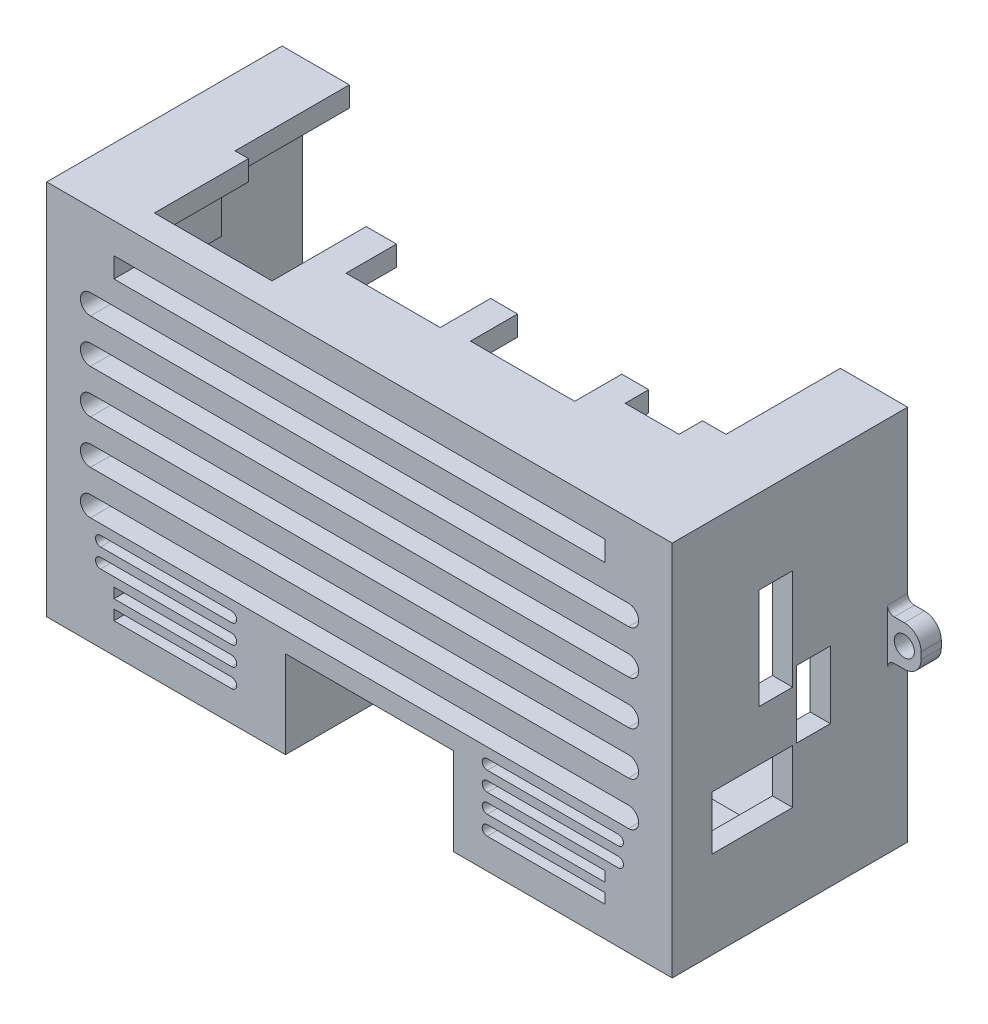
from build123d import *

# Parameters (mm, degrees)
EXTRUDE_1_DEPTH     = 35
CUT_EXTRUDE_1_DEPTH = 18
SKETCH_3_3_W        = 7
SKETCH_3_3_H        = 7
SKETCH_3_3_R        = 2
EXTRUDE_2_DEPTH     = 18
SKETCH_2_W          = 7
SKETCH_2_H          = 15.5
SKETCH_2_H_2        = 1.5
SKETCH_2_W_2        = 3
EXTRUDE_3_DEPTH     = 3
SKETCH_4_W          = 5
SKETCH_4_H          = 15
SKETCH_4_W_2        = 4
SKETCH_4_H_2        = 10
SKETCH_4_W_3        = 12
SKETCH_4_H_3        = 8
SKETCH_4_W_4        = 1
CUT_EXTRUDE_2_DEPTH = 3
CUT_EXTRUDE_START   = -16
SKETCH_3_5_W        = 7
SKETCH_3_5_H        = 7
SKETCH_3_5_R        = 2
CUT_EXTRUDE_3_DEPTH = 2
SKETCH_5_W          = 93
SKETCH_5_H          = 56
EXTRUDE_4_DEPTH     = 3
SKETCH_3_7_W        = 25
SKETCH_3_7_H        = 3
SKETCH_3_7_H_2      = 10
SKETCH_3_7_W_2      = 4
SKETCH_3_7_H_3      = 2.5
CUT_EXTRUDE_4_DEPTH = 18
SKETCH_6_W          = 73
SKETCH_6_H          = 3
CUT_EXTRUDE_5_DEPTH = 3
SKETCH_8_R          = 1.5
EXTRUDE_5_DEPTH     = 3


# Read off the part's stored shape, not the designer's step: 凸台-拉伸1
with BuildPart() as part:
    # 凸台-拉伸1 outline → 凸台-拉伸1 (new body)
    with BuildSketch(Plane.XY):
        Polygon((43.5, -25), (-43.5, -25), (-43.5, 25), (-36.5, 25), (-36.5, 28), (-46.5, 28), (-46.5, -28), (46.5, -28), (46.5, 28), (36.5, 28), (36.5, 25), (43.5, 25), align=None)
    extrude(amount=EXTRUDE_1_DEPTH)

    # 草图3 → 切除-拉伸1 (cut)
    with BuildSketch(Plane.XY.offset(35)):
        Polygon((-46.5, -28), (-36.5, -28), (-36.5, -25), (-43.5, -25), (-43.5, -18), (-46.5, -18), align=None)
        Polygon((36.5, -25), (36.5, -28), (46.5, -28), (46.5, 18), (43.5, 18), (43.5, -25), align=None)
        Polygon((-43.5, 25), (-36.5, 25), (-36.5, 28), (-46.5, 28), (-46.5, 18), (-43.5, 18), align=None)
    extrude(amount=-CUT_EXTRUDE_1_DEPTH, mode=Mode.SUBTRACT)

    # 草图3<3> → 凸台-拉伸2 (add)
    # profile 1 of 9: a face of its own
    with BuildSketch(Plane.XY.offset(35)):
        with Locations((-40, 21.5)):
            Rectangle(SKETCH_3_3_W, SKETCH_3_3_H)
        with Locations((-39.5, 21)):
            Circle(SKETCH_3_3_R, mode=Mode.SUBTRACT)
    # profile 2 of 9: a face of its own
    with BuildSketch(Plane.XY.offset(35)):
        with Locations((-40, -21.5)):
            Rectangle(SKETCH_3_3_W, SKETCH_3_3_H)
        with Locations((-39.5, -21)):
            Circle(SKETCH_3_3_R, mode=Mode.SUBTRACT)
    # profile 3 of 9: a face of its own
    with BuildSketch(Plane.XY.offset(35)):
        with Locations((40, -21.5)):
            Rectangle(SKETCH_3_3_W, SKETCH_3_3_H)
        with Locations((39.5, -21)):
            Circle(SKETCH_3_3_R, mode=Mode.SUBTRACT)
    # profile 4 of 9: a face of its own
    with BuildSketch(Plane.XY.offset(35)):
        with Locations((40, 21.5)):
            Rectangle(SKETCH_3_3_W, SKETCH_3_3_H)
        with Locations((39.5, 21)):
            Circle(SKETCH_3_3_R, mode=Mode.SUBTRACT)
    # profile 5 of 9: a face of its own
    with BuildSketch(Plane.XY.offset(35)):
        Polygon((-46.5, -28), (-36.5, -28), (-36.5, -25), (-43.5, -25), (-43.5, -18), (-46.5, -18), align=None)
    # profile 6 of 9: a face of its own
    with BuildSketch(Plane.XY.offset(35)):
        Polygon((36.5, -25), (36.5, -28), (46.5, -28), (46.5, -18), (43.5, -18), (43.5, -25), align=None)
    # profile 7 of 9: a face of its own
    with BuildSketch(Plane.XY.offset(35)):
        Polygon((43.5, -18), (46.5, -18), (46.5, 18), (43.5, 18), (43.5, 17), (43.5, 15), (43.5, 1), (43.5, -7.5), (43.5, -14.5), (43.5, -17), align=None)
    # profile 8 of 9: a face of its own
    with BuildSketch(Plane.XY.offset(35)):
        Polygon((-43.5, 25), (-36.5, 25), (-36.5, 28), (-46.5, 28), (-46.5, 18), (-43.5, 18), align=None)
    # profile 9 of 9: a face of its own
    with BuildSketch(Plane.XY.offset(35)):
        Polygon((-11, -25), (-11, -15), (14, -15), (14, -25), (17, -25), (17, -12), (-14, -12), (-14, -25), align=None)
    extrude(amount=-EXTRUDE_2_DEPTH)

    # 草图2 → 凸台-拉伸3 (add)
    with BuildSketch(Plane(origin=(0, 28, 0), x_dir=(1, 0, 0), z_dir=(0, 1, 0))):
        Polygon((-43.5, -17), (-46.5, -17), (-46.5, -35), (36.5, -35), (36.5, -32.5), (-43.5, -32.5), align=None)
        Polygon((36.5, -32.5), (36.5, -17), (33, -17), (33, -20.5), (25, -20.5), (25, -17), (21, -17), (21, -24), (5.5, -24), (5.5, -17), (1.5, -17), (1.5, -24.5), (-12.5, -24.5), (-12.5, -17), (-17, -17), (-17, -31), (-34.5, -31), (-34.5, -17), (-43.5, -17), (-43.5, -32.5), align=None)
        Polygon((46.5, -35), (46.5, -17), (43.5, -17), (43.5, -32.5), (36.5, -32.5), (36.5, -35), align=None)
        with Locations((40, -24.75)):
            Rectangle(SKETCH_2_W, SKETCH_2_H)
        with Locations((40, -16.25)):
            Rectangle(SKETCH_2_W, SKETCH_2_H_2)
        with Locations((45, -16.25)):
            Rectangle(SKETCH_2_W_2, SKETCH_2_H_2)
        with Locations((-45, -16.25)):
            Rectangle(SKETCH_2_W_2, SKETCH_2_H_2)
    extrude(amount=-EXTRUDE_3_DEPTH)

    # 草图4 → 切除-拉伸2 (cut)
    with BuildSketch(Plane(origin=(46.5, 0, 0), x_dir=(0, 0, -1), z_dir=(1, 0, 0))):
        with Locations((-19.6, 8)):
            Rectangle(SKETCH_4_W, SKETCH_4_H)
        with Locations((-13.5, -2)):
            Rectangle(SKETCH_4_W_2, SKETCH_4_H_2)
        with Locations((-23.1, -11)):
            Rectangle(SKETCH_4_W_3, SKETCH_4_H_3)
        with Locations((-16, -2)):
            Rectangle(SKETCH_4_W_4, SKETCH_4_H_2)
    extrude(amount=-CUT_EXTRUDE_2_DEPTH, mode=Mode.SUBTRACT)

    # 草图3<5> → 切除-拉伸3 (cut)
    # profile 1 of 4: a face of its own
    with BuildSketch(Plane.XY.offset(35).offset(CUT_EXTRUDE_START)):
        with Locations((-40, 21.5)):
            Rectangle(SKETCH_3_5_W, SKETCH_3_5_H)
        with Locations((-39.5, 21)):
            Circle(SKETCH_3_5_R, mode=Mode.SUBTRACT)
    # profile 2 of 4: a face of its own
    with BuildSketch(Plane.XY.offset(35).offset(CUT_EXTRUDE_START)):
        with Locations((-40, -21.5)):
            Rectangle(SKETCH_3_5_W, SKETCH_3_5_H)
        with Locations((-39.5, -21)):
            Circle(SKETCH_3_5_R, mode=Mode.SUBTRACT)
    # profile 3 of 4: a face of its own
    with BuildSketch(Plane.XY.offset(35).offset(CUT_EXTRUDE_START)):
        with Locations((40, -21.5)):
            Rectangle(SKETCH_3_5_W, SKETCH_3_5_H)
        with Locations((39.5, -21)):
            Circle(SKETCH_3_5_R, mode=Mode.SUBTRACT)
    # profile 4 of 4: a face of its own
    with BuildSketch(Plane.XY.offset(35).offset(CUT_EXTRUDE_START)):
        with Locations((40, 21.5)):
            Rectangle(SKETCH_3_5_W, SKETCH_3_5_H)
        with Locations((39.5, 21)):
            Circle(SKETCH_3_5_R, mode=Mode.SUBTRACT)
    extrude(amount=-CUT_EXTRUDE_3_DEPTH, mode=Mode.SUBTRACT)

    # 草图5 → 凸台-拉伸4 (add)
    with BuildSketch(Plane.XY.offset(35)):
        Rectangle(SKETCH_5_W, SKETCH_5_H)
    extrude(amount=-EXTRUDE_4_DEPTH)

    # 草图3<7> → 切除-拉伸4 (cut)
    # profile 1 of 8: a face of its own
    with BuildSketch(Plane.XY.offset(35)):
        with Locations((1.5, -26.5)):
            Rectangle(SKETCH_3_7_W, SKETCH_3_7_H)
    # profile 2 of 8: a face of its own
    with BuildSketch(Plane.XY.offset(35)):
        with Locations((1.5, -20)):
            Rectangle(SKETCH_3_7_W, SKETCH_3_7_H_2)
        with Locations((-6.5, -22.25)):
            Rectangle(SKETCH_3_7_W_2, SKETCH_3_7_H_3, mode=Mode.SUBTRACT)
        with Locations((1.5, -22.25)):
            Rectangle(SKETCH_3_7_W_2, SKETCH_3_7_H_3, mode=Mode.SUBTRACT)
        with Locations((9.5, -22.25)):
            Rectangle(SKETCH_3_7_W_2, SKETCH_3_7_H_3, mode=Mode.SUBTRACT)
    # profile 3 of 8: a face of its own
    with BuildSketch(Plane.XY.offset(35)):
        with Locations((-6.5, -22.25)):
            Rectangle(SKETCH_3_7_W_2, SKETCH_3_7_H_3)
        with BuildLine():
            ThreePointArc((-5.5, -23), (-4.75, -22.25), (-5.5, -21.5))
            Line((-5.5, -21.5), (-7.5, -21.5))
            ThreePointArc((-7.5, -21.5), (-8.25, -22.25), (-7.5, -23))
            Line((-7.5, -23), (-5.5, -23))
        make_face(mode=Mode.SUBTRACT)
    # profile 4 of 8: a face of its own
    with BuildSketch(Plane.XY.offset(35)):
        with BuildLine():
            Line((-7.5, -23), (-5.5, -23))
            ThreePointArc((-5.5, -23), (-4.75, -22.25), (-5.5, -21.5))
            Line((-5.5, -21.5), (-7.5, -21.5))
            ThreePointArc((-7.5, -21.5), (-8.25, -22.25), (-7.5, -23))
        make_face()
    # profile 5 of 8: a face of its own
    with BuildSketch(Plane.XY.offset(35)):
        with Locations((1.5, -22.25)):
            Rectangle(SKETCH_3_7_W_2, SKETCH_3_7_H_3)
        with BuildLine():
            ThreePointArc((2.5, -23), (3.25, -22.25), (2.5, -21.5))
            Line((2.5, -21.5), (0.5, -21.5))
            ThreePointArc((0.5, -21.5), (-0.25, -22.25), (0.5, -23))
            Line((0.5, -23), (2.5, -23))
        make_face(mode=Mode.SUBTRACT)
    # profile 6 of 8: a face of its own
    with BuildSketch(Plane.XY.offset(35)):
        with BuildLine():
            Line((0.5, -23), (2.5, -23))
            ThreePointArc((2.5, -23), (3.25, -22.25), (2.5, -21.5))
            Line((2.5, -21.5), (0.5, -21.5))
            ThreePointArc((0.5, -21.5), (-0.25, -22.25), (0.5, -23))
        make_face()
    # profile 7 of 8: a face of its own
    with BuildSketch(Plane.XY.offset(35)):
        with Locations((9.5, -22.25)):
            Rectangle(SKETCH_3_7_W_2, SKETCH_3_7_H_3)
        with BuildLine():
            ThreePointArc((10.5, -23), (11.25, -22.25), (10.5, -21.5))
            Line((10.5, -21.5), (8.5, -21.5))
            ThreePointArc((8.5, -21.5), (7.75, -22.25), (8.5, -23))
            Line((8.5, -23), (10.5, -23))
        make_face(mode=Mode.SUBTRACT)
    # profile 8 of 8: a face of its own
    with BuildSketch(Plane.XY.offset(35)):
        with BuildLine():
            Line((8.5, -23), (10.5, -23))
            ThreePointArc((10.5, -23), (11.25, -22.25), (10.5, -21.5))
            Line((10.5, -21.5), (8.5, -21.5))
            ThreePointArc((8.5, -21.5), (7.75, -22.25), (8.5, -23))
        make_face()
    extrude(amount=-CUT_EXTRUDE_4_DEPTH, mode=Mode.SUBTRACT)

    # 草图6 → 切除-拉伸5 (cut)
    with BuildSketch(Plane.XY.offset(35)):
        with Locations((0, 22)):
            Rectangle(SKETCH_6_W, SKETCH_6_H)
        with BuildLine():
            Line((-19, -19.166666667), (-36.5, -19.166666667))
            Line((-36.5, -19.166666667), (-36.5, -20.666666667))
            Line((-36.5, -20.666666667), (-19, -20.666666667))
            ThreePointArc((-19, -20.666666667), (-18.25, -19.916666667), (-19, -19.166666667))
        make_face()
        with BuildLine():
            Line((-36.5, -22), (-36.5, -23.5))
            Line((-36.5, -23.5), (-19, -23.5))
            ThreePointArc((-19, -23.5), (-18.25, -22.75), (-19, -22))
            Line((-19, -22), (-36.5, -22))
        make_face()
        with BuildLine():
            Line((19, -23.5), (36.5, -23.5))
            Line((36.5, -23.5), (36.5, -22))
            Line((36.5, -22), (19, -22))
            ThreePointArc((19, -22), (18.25, -22.75), (19, -23.5))
        make_face()
        with BuildLine():
            Line((36.5, -20.666666667), (36.5, -19.166666667))
            Line((36.5, -19.166666667), (19, -19.166666667))
            ThreePointArc((19, -19.166666667), (18.25, -19.916666667), (19, -20.666666667))
            Line((19, -20.666666667), (36.5, -20.666666667))
        make_face()
        with BuildLine():
            Line((40, 17), (-40, 17))
            ThreePointArc((-40, 17), (-41.5, 15.5), (-40, 14))
            Line((-40, 14), (40, 14))
            ThreePointArc((40, 14), (41.5, 15.5), (40, 17))
        make_face()
        with BuildLine():
            Line((40, 10.5), (-40, 10.5))
            ThreePointArc((-40, 10.5), (-41.5, 9), (-40, 7.5))
            Line((-40, 7.5), (40, 7.5))
            ThreePointArc((40, 7.5), (41.5, 9), (40, 10.5))
        make_face()
        with BuildLine():
            Line((40, 4), (-40, 4))
            ThreePointArc((-40, 4), (-41.5, 2.5), (-40, 1))
            Line((-40, 1), (40, 1))
            ThreePointArc((40, 1), (41.5, 2.5), (40, 4))
        make_face()
        with BuildLine():
            Line((40, -2.5), (-40, -2.5))
            ThreePointArc((-40, -2.5), (-41.5, -4), (-40, -5.5))
            Line((-40, -5.5), (40, -5.5))
            ThreePointArc((40, -5.5), (41.5, -4), (40, -2.5))
        make_face()
        with BuildLine():
            Line((40, -9), (-40, -9))
            ThreePointArc((-40, -9), (-41.5, -10.5), (-40, -12))
            Line((-40, -12), (40, -12))
            ThreePointArc((40, -12), (41.5, -10.5), (40, -9))
        make_face()
        with BuildLine():
            Line((38.5, -13.5), (19, -13.5))
            ThreePointArc((19, -13.5), (18.25, -14.25), (19, -15))
            Line((19, -15), (38.5, -15))
            ThreePointArc((38.5, -15), (39.25, -14.25), (38.5, -13.5))
        make_face()
        with BuildLine():
            Line((38.5, -16.333333333), (19, -16.333333333))
            ThreePointArc((19, -16.333333333), (18.25, -17.083333333), (19, -17.833333333))
            Line((19, -17.833333333), (38.5, -17.833333333))
            ThreePointArc((38.5, -17.833333333), (39.25, -17.083333333), (38.5, -16.333333333))
        make_face()
        with BuildLine():
            ThreePointArc((-19, -17.833333333), (-18.25, -17.083333333), (-19, -16.333333333))
            Line((-19, -16.333333333), (-38.5, -16.333333333))
            ThreePointArc((-38.5, -16.333333333), (-39.25, -17.083333333), (-38.5, -17.833333333))
            Line((-38.5, -17.833333333), (-19, -17.833333333))
        make_face()
        with BuildLine():
            ThreePointArc((-19, -15), (-18.25, -14.25), (-19, -13.5))
            Line((-19, -13.5), (-38.5, -13.5))
            ThreePointArc((-38.5, -13.5), (-39.25, -14.25), (-38.5, -15))
            Line((-38.5, -15), (-19, -15))
        make_face()
    extrude(amount=-CUT_EXTRUDE_5_DEPTH, mode=Mode.SUBTRACT)

    # 草图8 → 凸台-拉伸5 (add)
    # profile 1 of 2: a face of its own
    with BuildSketch(Plane(origin=(0, 0, 0), x_dir=(-1, 0, 0), z_dir=(0, 0, -1))):
        with BuildLine():
            ThreePointArc((47.5, 3), (46.792893219, 3.292893219), (46.5, 4))
            Line((46.5, 4), (46.5, 3))
            Line((46.5, 3), (46.5, -3))
            Line((46.5, -3), (46.5, -4))
            ThreePointArc((46.5, -4), (46.792893219, -3.292893219), (47.5, -3))
            Line((47.5, -3), (47.899019222, -3))
            Line((47.899019222, -3), (49, -3))
            ThreePointArc((49, -3), (50.767766953, -2.267766953), (51.5, -0.5))
            Line((51.5, -0.5), (51.5, 0.5))
            ThreePointArc((51.5, 0.5), (50.767766953, 2.267766953), (49, 3))
            Line((49, 3), (47.899019222, 3))
            Line((47.899019222, 3), (47.5, 3))
        make_face()
        with Locations((49, 0)):
            Circle(SKETCH_8_R, mode=Mode.SUBTRACT)
    # profile 2 of 2: a face of its own
    with BuildSketch(Plane(origin=(0, 0, 0), x_dir=(-1, 0, 0), z_dir=(0, 0, -1))):
        with BuildLine():
            Line((-46.5, 3), (-46.5, 4))
            ThreePointArc((-46.5, 4), (-46.792893219, 3.292893219), (-47.5, 3))
            Line((-47.5, 3), (-47.899019222, 3))
            Line((-47.899019222, 3), (-49, 3))
            ThreePointArc((-49, 3), (-50.767766953, 2.267766953), (-51.5, 0.5))
            Line((-51.5, 0.5), (-51.5, -0.5))
            ThreePointArc((-51.5, -0.5), (-50.767766953, -2.267766953), (-49, -3))
            Line((-49, -3), (-47.899019222, -3))
            Line((-47.899019222, -3), (-47.5, -3))
            ThreePointArc((-47.5, -3), (-46.792893219, -3.292893219), (-46.5, -4))
            Line((-46.5, -4), (-46.5, -3))
            Line((-46.5, -3), (-46.5, 3))
        make_face()
        with Locations((-49, 0)):
            Circle(SKETCH_8_R, mode=Mode.SUBTRACT)
    extrude(amount=-EXTRUDE_5_DEPTH)


solid = part.part
